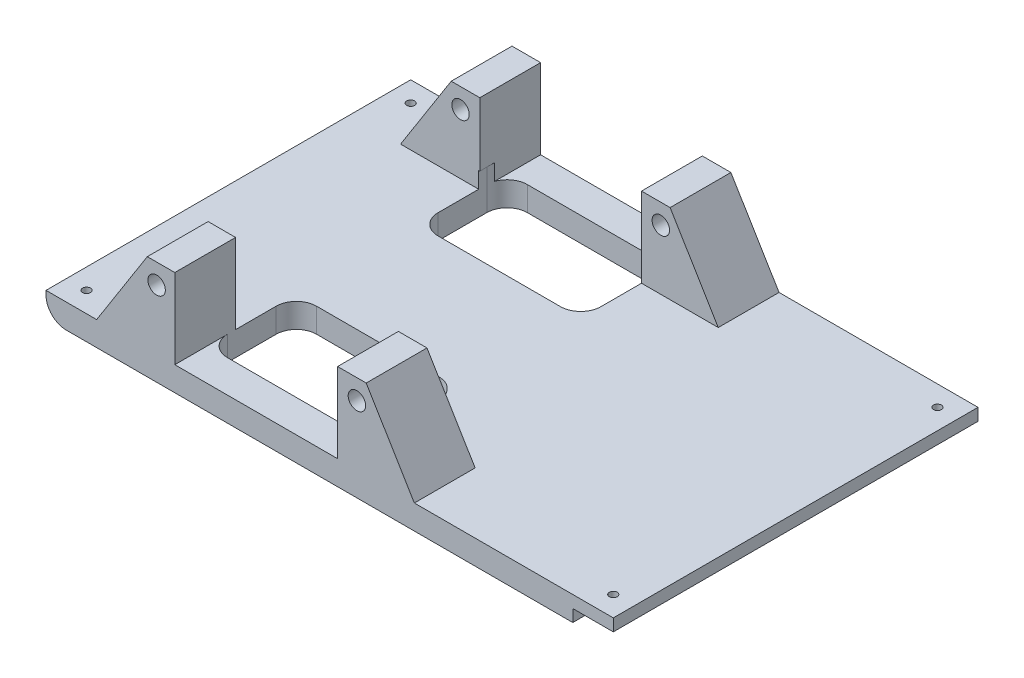
from build123d import *

# Parameters (mm, degrees)
SKIZZE1_W                             = 140
SKIZZE1_H                             = 90
AUFSATZ_LINEAR_AUSTRAGEN1_DEPTH       = 6
SKIZZE2_W                             = 10
SKIZZE2_H                             = 90
SCHNITT_LINEAR_AUSTRAGEN1_DEPTH       = 3
SKIZZE3_W                             = 7.06
SKIZZE3_H                             = 25.7
SKIZZE3_R                             = 2.1
AUFSATZ_LINEAR_AUSTRAGEN2_DEPTH       = 15
AUFSATZ_LINEAR_START                  = -15
SKIZZE4_W                             = 6.783859635
SKIZZE4_H                             = 25.7
SKIZZE4_R                             = 2.1
SKIZZE4_W_2                           = 7.06
AUFSATZ_LINEAR_AUSTRAGEN3_DEPTH       = 15
VERRUNDUNG1_R                         = 5
SCHNITT_LINEAR_AUSTRAGEN2_DEPTH       = 10
SKIZZE6_R                             = 0.975
SCHNITT_LINEAR_AUSTRAGEN3_DEPTH       = 10
SKIZZE7_R                             = 3.25
SCHNITT_LINEAR_AUSTRAGEN4_DEPTH       = 2
AUFSATZ_LINEAR_START_2                = -90
AUFSATZ_LINEAR_AUSTRAGEN4_OUTLINE_R   = 2.15
AUFSATZ_LINEAR_AUSTRAGEN4_OUTLINE_R_2 = 2.1
AUFSATZ_LINEAR_AUSTRAGEN4_DEPTH       = 90
AUFSATZ_LINEAR_AUSTRAGEN4_2_DEPTH     = 15
AUFSATZ_LINEAR_AUSTRAGEN5_DEPTH       = 15
AUFSATZ_LINEAR_AUSTRAGEN6_DEPTH       = 15


# Read off the part's stored shape, not the designer's step: Aufsatz-Linear austragen4
with BuildPart() as part:
    # Skizze1 → Aufsatz-Linear austragen1 (new body)
    with BuildSketch(Plane(origin=(0, 0, 0), x_dir=(1, 0, 0), z_dir=(0, 1, 0))):
        with Locations((70, 45)):
            Rectangle(SKIZZE1_W, SKIZZE1_H)
    extrude(amount=AUFSATZ_LINEAR_AUSTRAGEN1_DEPTH)

    # Skizze2 → Schnitt-Linear austragen1 (cut)
    with BuildSketch(Plane.XZ):
        with Locations((135, -45)):
            Rectangle(SKIZZE2_W, SKIZZE2_H)
    extrude(amount=-SCHNITT_LINEAR_AUSTRAGEN1_DEPTH, mode=Mode.SUBTRACT)

    # Skizze3 → Aufsatz-Linear austragen2 (add)
    # profile 1 of 2: a face of its own
    with BuildSketch(Plane(origin=(0, 0, -90), x_dir=(-1, 0, 0), z_dir=(0, 0, -1))):
        with Locations((-75.49, 12.85)):
            Rectangle(SKIZZE3_W, SKIZZE3_H)
        with Locations((-76.72, 20.78)):
            Circle(SKIZZE3_R, mode=Mode.SUBTRACT)
    # profile 2 of 2: a face of its own
    with BuildSketch(Plane(origin=(0, 0, -90), x_dir=(-1, 0, 0), z_dir=(0, 0, -1))):
        with Locations((-28.53, 12.85)):
            Rectangle(SKIZZE3_W, SKIZZE3_H)
        with Locations((-27.3, 20.78)):
            Circle(SKIZZE3_R, mode=Mode.SUBTRACT)
    extrude(amount=-AUFSATZ_LINEAR_AUSTRAGEN2_DEPTH)

    # Skizze4 → Aufsatz-Linear austragen3 (add)
    # profile 1 of 2: a face of its own
    with BuildSketch(Plane.XY.offset(AUFSATZ_LINEAR_START)):
        with Locations((28.391929817, 12.85)):
            Rectangle(SKIZZE4_W, SKIZZE4_H)
        with Locations(Location((27.3, 20.78, 0), (0, 0, 180))):
            Circle(SKIZZE4_R, mode=Mode.SUBTRACT)
    # profile 2 of 2: a face of its own
    with BuildSketch(Plane.XY.offset(AUFSATZ_LINEAR_START)):
        with Locations((75.49, 12.85)):
            Rectangle(SKIZZE4_W_2, SKIZZE4_H)
        with Locations(Location((76.72, 20.78, 0), (0, 0, 180))):
            Circle(SKIZZE4_R, mode=Mode.SUBTRACT)
    extrude(amount=AUFSATZ_LINEAR_AUSTRAGEN3_DEPTH)

    # Verrundung1
    verrundung1_edges = [part.edges().sort_by_distance(p)[0] for p in [
        (0, 0, -45),
    ]]
    fillet(verrundung1_edges, radius=VERRUNDUNG1_R)

    # Skizze5 → Schnitt-Linear austragen2 (cut)
    with BuildSketch(Plane(origin=(0, 0, 0), x_dir=(-1, 0, 0), z_dir=(0, -1, 0))):
        with BuildLine():
            Line((-36.783859635, 8), (-66.96, 8))
            ThreePointArc((-66.96, 8), (-70.495533906, 9.464466094), (-71.96, 13))
            Line((-71.96, 13), (-71.96, 25))
            ThreePointArc((-71.96, 25), (-70.495533906, 28.535533906), (-66.96, 30))
            Line((-66.96, 30), (-36.783859635, 30))
            ThreePointArc((-36.783859635, 30), (-33.248325729, 28.535533906), (-31.783859635, 25))
            Line((-31.783859635, 25), (-31.783859635, 13))
            ThreePointArc((-31.783859635, 13), (-33.248325729, 9.464466094), (-36.783859635, 8))
        make_face()
        with BuildLine():
            Line((-36.783859635, 82), (-66.96, 82))
            ThreePointArc((-66.96, 82), (-70.495533906, 80.535533906), (-71.96, 77))
            Line((-71.96, 77), (-71.96, 65))
            ThreePointArc((-71.96, 65), (-70.495533906, 61.464466094), (-66.96, 60))
            Line((-66.96, 60), (-36.783859635, 60))
            ThreePointArc((-36.783859635, 60), (-33.248325729, 61.464466094), (-31.783859635, 65))
            Line((-31.783859635, 65), (-31.783859635, 77))
            ThreePointArc((-31.783859635, 77), (-33.248325729, 80.535533906), (-36.783859635, 82))
        make_face()
    extrude(amount=-SCHNITT_LINEAR_AUSTRAGEN2_DEPTH, mode=Mode.SUBTRACT)

    # Skizze6 → Schnitt-Linear austragen3 (cut)
    with BuildSketch(Plane.XZ):
        with Locations(Location((135, -5, 0), (0, 0, 270))):
            Circle(SKIZZE6_R)
        with Locations(Location((5, -85, 0), (0, 0, 270))):
            Circle(SKIZZE6_R)
        with Locations(Location((135, -85, 0), (0, 0, 270))):
            Circle(SKIZZE6_R)
        with Locations(Location((5, -5, 0), (0, 0, 270))):
            Circle(SKIZZE6_R)
    extrude(amount=-SCHNITT_LINEAR_AUSTRAGEN3_DEPTH, mode=Mode.SUBTRACT)

    # Skizze7 → Schnitt-Linear austragen4 (cut)
    with BuildSketch(Plane.XZ):
        with Locations(Location((5, -5, 0), (0, 0, 270))):
            Circle(SKIZZE7_R)
        with Locations(Location((5, -85, 0), (0, 0, 270))):
            Circle(SKIZZE7_R)
    extrude(amount=-SCHNITT_LINEAR_AUSTRAGEN4_DEPTH, mode=Mode.SUBTRACT)

    # Aufsatz-Linear austragen4 outline → Aufsatz-Linear austragen4 (cut)
    # profile 1 of 2: a face of its own
    with BuildSketch(Plane(origin=(0, 0, -90), x_dir=(-1, 0, 0), z_dir=(0, 0, -1)).offset(AUFSATZ_LINEAR_START_2)):
        with Locations((-76.72, 20.78)):
            Circle(AUFSATZ_LINEAR_AUSTRAGEN4_OUTLINE_R)
        with Locations((-76.72, 20.78)):
            Circle(AUFSATZ_LINEAR_AUSTRAGEN4_OUTLINE_R_2, mode=Mode.SUBTRACT)
    # profile 2 of 2: a face of its own
    with BuildSketch(Plane(origin=(0, 0, -90), x_dir=(-1, 0, 0), z_dir=(0, 0, -1)).offset(AUFSATZ_LINEAR_START_2)):
        with Locations((-27.3, 20.78)):
            Circle(AUFSATZ_LINEAR_AUSTRAGEN4_OUTLINE_R)
        with Locations((-27.3, 20.78)):
            Circle(AUFSATZ_LINEAR_AUSTRAGEN4_OUTLINE_R_2, mode=Mode.SUBTRACT)
    extrude(amount=AUFSATZ_LINEAR_AUSTRAGEN4_DEPTH, mode=Mode.SUBTRACT)

    # Aufsatz-Linear austragen4 2 outline → Aufsatz-Linear austragen4 2 (add)
    with BuildSketch(Plane(origin=(0, 0, -90), x_dir=(-1, 0, 0), z_dir=(0, 0, -1)).offset(AUFSATZ_LINEAR_START)):
        Polygon((-79.02, 6), (-79.02, 25.7), (-90.903397377, 6), align=None)
    extrude(amount=AUFSATZ_LINEAR_AUSTRAGEN4_2_DEPTH)

    # Skizze10 → Aufsatz-Linear austragen5 (add)
    with BuildSketch(Plane(origin=(0, 0, -90), x_dir=(-1, 0, 0), z_dir=(0, 0, -1))):
        Polygon((-25, 25.7), (-12.5, 6), (-25, 6), align=None)
    extrude(amount=-AUFSATZ_LINEAR_AUSTRAGEN5_DEPTH)

    # Skizze11 → Aufsatz-Linear austragen6 (add)
    with BuildSketch(Plane.XY):
        Polygon((25, 25.7), (12.5, 6), (25, 6), align=None)
        Polygon((79.02, 25.7), (79.02, 6), (90.903397377, 6), align=None)
    extrude(amount=-AUFSATZ_LINEAR_AUSTRAGEN6_DEPTH)


solid = part.part
